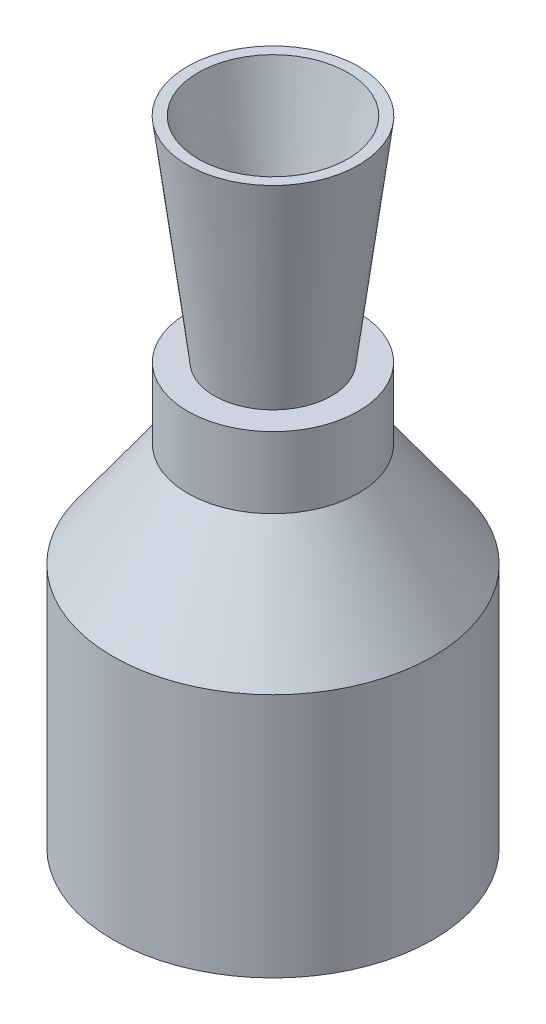
from build123d import *

# Parameters (mm, degrees)
SKETCH1_R           = 22.5
SKETCH1_R_2         = 20.5
BOSS_EXTRUDE1_DEPTH = 34.5


with BuildPart() as part:
    # Sketch1 → Boss-Extrude1 (new body)
    with BuildSketch(Plane(origin=(0, 0, 0), x_dir=(1, 0, 0), z_dir=(0, 1, 0))):
        Circle(SKETCH1_R)
        Circle(SKETCH1_R_2, mode=Mode.SUBTRACT)
    extrude(amount=BOSS_EXTRUDE1_DEPTH)

    # Sketch5 → Revolve1 (revolve)
    with BuildSketch(Plane.XY):
        Polygon((22.5, 34.5), (12, 49.120191517), (12, 59.120191517), (3.5, 59.120191517), (3.5, 49.120191517), (20.5, 34.5), align=None)
    revolve(axis=Axis((0, 0, 0), (0, 1, 0)))

    # Sketch10 → Revolve3 (revolve)
    with BuildSketch(Plane(origin=(0, 0, 0), x_dir=(-1, 0, 0), z_dir=(0, 0, -1))):
        Polygon((-3.5, 59.120191517), (-10.526661033, 89.120191517), (-12.026661033, 89.120191517), (-8.25, 59.120191517), align=None)
    revolve(axis=Axis((0, 59.120191517, 0), (0, 1, 0)))


solid = part.part
